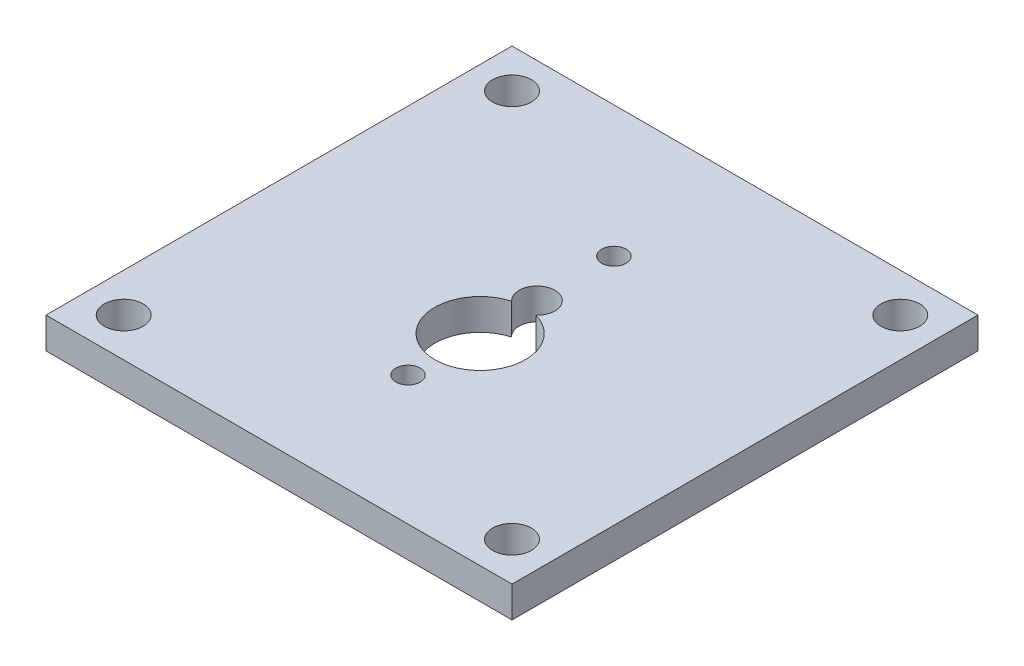
from build123d import *

# Parameters (mm, degrees)
SKETCH1_W           = 60
SKETCH1_H           = 60
SKETCH1_R           = 2.5
SKETCH1_R_2         = 1.565369694
SKETCH1_R_3         = 1.574825853
BOSS_EXTRUDE3_DEPTH = 4


with BuildPart() as part:
    # Sketch1 → Boss-Extrude3 (new body)
    with BuildSketch(Plane(origin=(0, 0, 0), x_dir=(1, 0, 0), z_dir=(0, 1, 0))):
        Rectangle(SKETCH1_W, SKETCH1_H)
        with Locations((-25, -25)):
            Circle(SKETCH1_R, mode=Mode.SUBTRACT)
        with Locations((25, -25)):
            Circle(SKETCH1_R, mode=Mode.SUBTRACT)
        with Locations((0, -13.383923357)):
            Circle(SKETCH1_R_2, mode=Mode.SUBTRACT)
        with BuildLine():
            ThreePointArc((1.565369694, 1.521349139), (0, -9.941678623), (-1.565369694, 1.521349139))
            ThreePointArc((-1.565369694, 1.521349139), (0, 5.524833323), (1.565369694, 1.521349139))
        make_face(mode=Mode.SUBTRACT)
        with Locations((-25, 25)):
            Circle(SKETCH1_R, mode=Mode.SUBTRACT)
        with Locations((0, 13.12549391)):
            Circle(SKETCH1_R_3, mode=Mode.SUBTRACT)
        with Locations((25, 25)):
            Circle(SKETCH1_R, mode=Mode.SUBTRACT)
    extrude(amount=BOSS_EXTRUDE3_DEPTH)


solid = part.part
